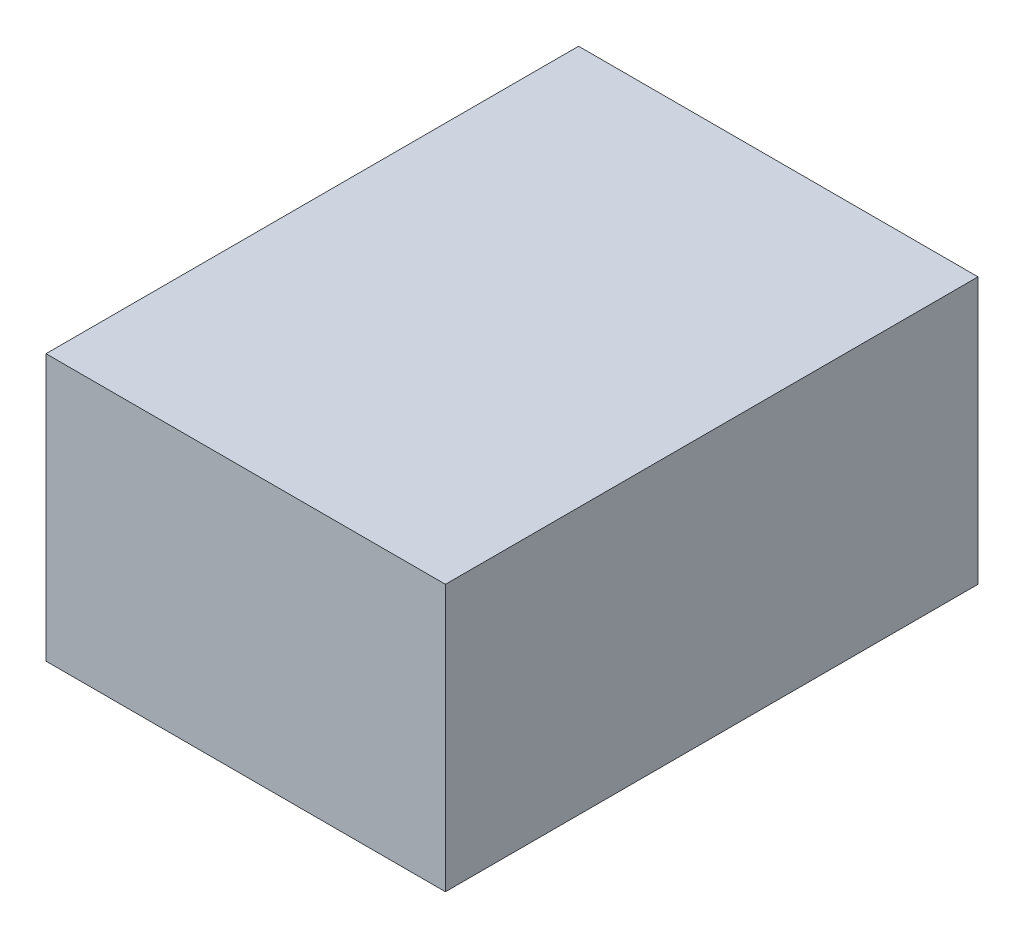
from build123d import *

# Parameters (mm, degrees)
SKETCH_1_W      = 60
SKETCH_1_H      = 80
EXTRUDE_1_DEPTH = 40


with BuildPart() as part:
    # 草图1 → 凸台-拉伸1 (new body)
    with BuildSketch(Plane(origin=(0, 0, 0), x_dir=(1, 0, 0), z_dir=(0, 1, 0))):
        Rectangle(SKETCH_1_W, SKETCH_1_H)
    extrude(amount=EXTRUDE_1_DEPTH)


solid = part.part
